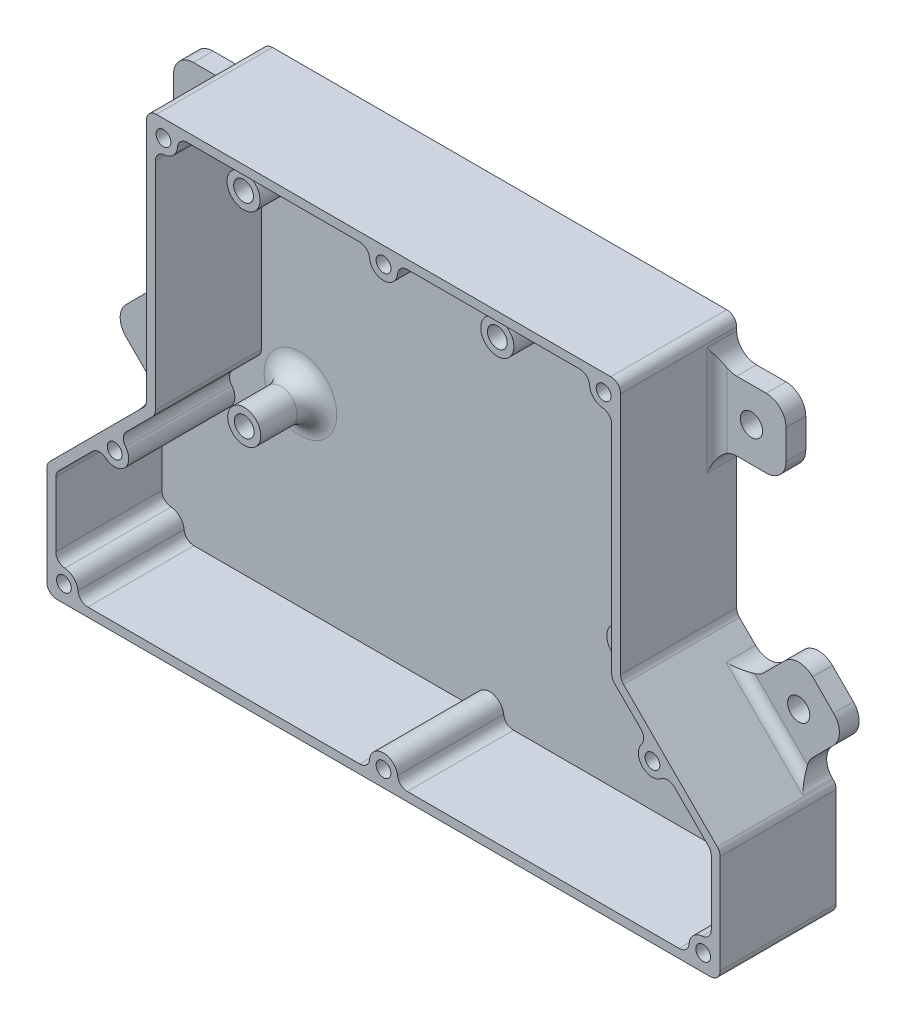
from build123d import *

# Parameters (mm, degrees)
BOSS_EXTRUDE1_DEPTH       = 2
BOSS_EXTRUDE2_DEPTH       = 21.5
FILLET1_R                 = 2
FILLET2_R                 = 2
BOSS_EXTRUDE3_START       = -22
BOSS_EXTRUDE3_OUTLINE_R   = 1.498302823
BOSS_EXTRUDE3_OUTLINE_R_2 = 1.5
BOSS_EXTRUDE3_DEPTH       = 22
FILLET3_R                 = 2
SKETCH5_R                 = 3.35
SKETCH5_R_2               = 2
BOSS_EXTRUDE4_DEPTH       = 11.389696517
FILLET4_R                 = 4
SKETCH6_W                 = 14
SKETCH6_H                 = 14
SKETCH6_R                 = 2.25
BOSS_EXTRUDE5_DEPTH       = 4
FILLET5_R                 = 4
FILLET6_R                 = 2


with BuildPart() as part:
    # Sketch3 → Boss-Extrude1 (new body)
    with BuildSketch(Plane.XY):
        Polygon((-15.640963985, -84.058941087), (4.526340861, -63.891636241), (4.526340861, -11.788708514), (100.581340861, -11.788708514), (100.581340861, -63.896636241), (120.743645706, -84.058941087), (120.743645706, -106.958318205), (104.551340861, -106.958318205), (-15.640963985, -106.958318205), (-15.640963985, -90.76601336), align=None)
    extrude(amount=-BOSS_EXTRUDE1_DEPTH)

    # Sketch3<3> → Boss-Extrude2 (add)
    with BuildSketch(Plane.XY):
        Polygon((-15.640963985, -90.76601336), (-15.640963985, -84.058941087), (4.526340861, -63.891636241), (4.526340861, -11.788708514), (100.581340861, -11.788708514), (100.581340861, -63.896636241), (120.743645706, -84.058941087), (120.743645706, -106.958318205), (104.551340861, -106.958318205), (-15.640963985, -106.958318205), align=None)
        Polygon((-13.840963985, -90.76601336), (-13.840963985, -105.158318205), (104.551340861, -105.158318205), (118.943645706, -105.158318205), (118.943645706, -84.804525499), (98.781340861, -64.642220653), (98.781340861, -13.588708514), (6.326340861, -13.588708514), (6.326340861, -64.637220653), (-13.840963985, -84.804525499), align=None, mode=Mode.SUBTRACT)
    extrude(amount=BOSS_EXTRUDE2_DEPTH)

    # Fillet1
    fillet1_edges = [part.edges().sort_by_distance(p)[0] for p in [
        (-15.640963985, -84.058941087, 9.75),
        (4.526340861, -63.891636241, 9.75),
        (4.526340861, -11.788708514, 9.75),
        (100.581340861, -11.788708514, 9.75),
        (100.581340861, -63.896636241, 9.75),
        (120.743645706, -84.058941087, 9.75),
        (120.743645706, -106.958318205, 9.75),
        (-15.640963985, -106.958318205, 9.75),
        (-13.840963985, -105.158318205, 10.75),
        (-13.840963985, -84.804525499, 10.75),
        (6.326340861, -64.637220653, 10.75),
        (6.326340861, -13.588708514, 10.75),
        (98.781340861, -13.588708514, 10.75),
        (98.781340861, -64.642220653, 10.75),
        (118.943645706, -105.158318205, 10.75),
    ]]
    fillet(fillet1_edges, radius=FILLET1_R)

    # Fillet2
    fillet2_edges = [part.edges().sort_by_distance(p)[0] for p in [
        (118.943645706, -84.804525499, 10.75),
    ]]
    fillet(fillet2_edges, radius=FILLET2_R)

    # Boss-Extrude3: read off the stored shape, not the designer's step
    # Boss-Extrude3 outline → Boss-Extrude3 (add)
    with BuildSketch(Plane.XY.offset(21.5).offset(BOSS_EXTRUDE3_START)):
        with BuildLine():
            ThreePointArc((101.167127298, -64.482422679), (100.733581796, -63.833575981), (100.581340861, -63.068209116))
            Line((100.581340861, -63.068209116), (100.581340861, -13.788708514))
            ThreePointArc((100.581340861, -13.788708514), (99.995554423, -12.374494952), (98.581340861, -11.788708514))
            Line((98.581340861, -11.788708514), (6.526340861, -11.788708514))
            ThreePointArc((6.526340861, -11.788708514), (5.112127298, -12.374494952), (4.526340861, -13.788708514))
            Line((4.526340861, -13.788708514), (4.526340861, -63.063209116))
            ThreePointArc((4.526340861, -63.063209116), (4.374099926, -63.828575981), (3.940554423, -64.477422679))
            Line((3.940554423, -64.477422679), (-15.055177547, -83.473154649))
            ThreePointArc((-15.055177547, -83.473154649), (-15.48872305, -84.122001347), (-15.640963985, -84.887368211))
            Line((-15.640963985, -84.887368211), (-15.640963985, -104.958318205))
            ThreePointArc((-15.640963985, -104.958318205), (-15.055177547, -106.372531767), (-13.640963985, -106.958318205))
            Line((-13.640963985, -106.958318205), (118.743645706, -106.958318205))
            ThreePointArc((118.743645706, -106.958318205), (120.157859269, -106.372531767), (120.743645706, -104.958318205))
            Line((120.743645706, -104.958318205), (120.743645706, -84.887368211))
            ThreePointArc((120.743645706, -84.887368211), (120.591404771, -84.122001347), (120.157859269, -83.473154649))
            Line((120.157859269, -83.473154649), (101.167127298, -64.482422679))
        make_face()
        with Locations((-12.195717461, -103.513071681)):
            Circle(BOSS_EXTRUDE3_OUTLINE_R, mode=Mode.SUBTRACT)
        with Locations((-1.913886606, -74.998768464)):
            Circle(BOSS_EXTRUDE3_OUTLINE_R_2, mode=Mode.SUBTRACT)
        with Locations((52.551340861, -103.658318205)):
            Circle(BOSS_EXTRUDE3_OUTLINE_R_2, mode=Mode.SUBTRACT)
        with Locations((117.297199097, -103.511871596)):
            Circle(BOSS_EXTRUDE3_OUTLINE_R_2, mode=Mode.SUBTRACT)
        with Locations((107.016568327, -74.998768464)):
            Circle(BOSS_EXTRUDE3_OUTLINE_R_2, mode=Mode.SUBTRACT)
        with BuildLine():
            ThreePointArc((-13.840963985, -85.632952624), (-13.68872305, -84.867585759), (-13.255177547, -84.218739061))
            Line((-13.255177547, -84.218739061), (-4.688095726, -75.651657241))
            ThreePointArc((-4.688095726, -75.651657241), (0.101367721, -77.01402279), (-1.260997829, -72.224559343))
            Line((-1.260997829, -72.224559343), (5.740554423, -65.223007091))
            ThreePointArc((5.740554423, -65.223007091), (6.174099926, -64.574160393), (6.326340861, -63.808793529))
            Line((6.326340861, -63.808793529), (6.326340861, -17.561464123))
            ThreePointArc((6.326340861, -17.561464123), (9.988041797, -17.25040945), (10.29909647, -13.588708514))
            Line((10.29909647, -13.588708514), (50.130516698, -13.588708514))
            ThreePointArc((50.130516698, -13.588708514), (52.553840861, -17.938708514), (54.977165024, -13.588708514))
            Line((54.977165024, -13.588708514), (94.808585252, -13.588708514))
            ThreePointArc((94.808585252, -13.588708514), (95.119639925, -17.25040945), (98.781340861, -17.561464123))
            Line((98.781340861, -17.561464123), (98.781340861, -63.813793529))
            ThreePointArc((98.781340861, -63.813793529), (98.933581796, -64.579160393), (99.367127298, -65.228007091))
            Line((99.367127298, -65.228007091), (106.36367955, -72.224559343))
            ThreePointArc((106.36367955, -72.224559343), (105.001314001, -77.01402279), (109.790777448, -75.651657241))
            Line((109.790777448, -75.651657241), (118.357859269, -84.218739061))
            ThreePointArc((118.357859269, -84.218739061), (118.791404771, -84.867585759), (118.943645706, -85.632952624))
            Line((118.943645706, -85.632952624), (118.943645706, -101.185562596))
            ThreePointArc((118.943645706, -101.185562596), (115.28194477, -101.496617269), (114.970890097, -105.158318205))
            Line((114.970890097, -105.158318205), (54.974665024, -105.158318205))
            ThreePointArc((54.974665024, -105.158318205), (52.551340861, -100.808318205), (50.128016698, -105.158318205))
            Line((50.128016698, -105.158318205), (-9.870638356, -105.158318205))
            ThreePointArc((-9.870638356, -105.158318205), (-10.18166322, -101.49901744), (-13.840963985, -101.187992576))
            Line((-13.840963985, -101.187992576), (-13.840963985, -85.632952624))
        make_face(mode=Mode.SUBTRACT)
        with Locations((7.97278747, -15.235155124)):
            Circle(BOSS_EXTRUDE3_OUTLINE_R_2, mode=Mode.SUBTRACT)
        with Locations((52.553840861, -15.088708514)):
            Circle(BOSS_EXTRUDE3_OUTLINE_R_2, mode=Mode.SUBTRACT)
        with Locations((97.134894251, -15.235155124)):
            Circle(BOSS_EXTRUDE3_OUTLINE_R_2, mode=Mode.SUBTRACT)
    extrude(amount=BOSS_EXTRUDE3_DEPTH)

    # Fillet3
    fillet3_edges = [part.edges().sort_by_distance(p)[0] for p in [
        (10.29909647, -13.588708514, 10.75),
        (6.326340861, -17.561464123, 10.75),
        (54.977165024, -13.588708514, 10.75),
        (50.130516698, -13.588708514, 10.75),
        (94.808585252, -13.588708514, 10.75),
        (98.781340861, -17.561464123, 10.75),
        (109.790777448, -75.651657241, 10.75),
        (106.36367955, -72.224559343, 10.75),
        (118.943645706, -101.185562596, 10.75),
        (114.970890097, -105.158318205, 10.75),
        (50.128016698, -105.158318205, 10.75),
        (54.974665024, -105.158318205, 10.75),
        (-9.870638356, -105.158318205, 10.75),
        (-13.840963985, -101.187992576, 10.75),
        (-4.688095726, -75.651657241, 10.75),
        (-1.260997829, -72.224559343, 10.75),
    ]]
    fillet(fillet3_edges, radius=FILLET3_R)

    # Sketch5 → Boss-Extrude4 (add)
    # profile 1 of 4: a face of its own
    with BuildSketch(Plane.XY):
        with Locations(Location((14.085540861, -26.462708514, 0), (0, 0, 270))):
            Circle(SKETCH5_R)
        with Locations(Location((14.085540861, -26.462708514, 0), (0, 0, 270))):
            Circle(SKETCH5_R_2, mode=Mode.SUBTRACT)
    # profile 2 of 4: a face of its own
    with BuildSketch(Plane.XY):
        with Locations(Location((14.225240861, -67.737708514, 0), (0, 0, 270))):
            Circle(SKETCH5_R)
        with Locations(Location((14.225240861, -67.737708514, 0), (0, 0, 270))):
            Circle(SKETCH5_R_2, mode=Mode.SUBTRACT)
    # profile 3 of 4: a face of its own
    with BuildSketch(Plane.XY):
        with Locations(Location((65.495140861, -26.462708514, 0), (0, 0, 270))):
            Circle(SKETCH5_R)
        with Locations(Location((65.495140861, -26.462708514, 0), (0, 0, 270))):
            Circle(SKETCH5_R_2, mode=Mode.SUBTRACT)
    # profile 4 of 4: a face of its own
    with BuildSketch(Plane.XY):
        with Locations(Location((91.034840861, -67.737708514, 0), (0, 0, 270))):
            Circle(SKETCH5_R)
        with Locations(Location((91.034840861, -67.737708514, 0), (0, 0, 270))):
            Circle(SKETCH5_R_2, mode=Mode.SUBTRACT)
    extrude(amount=BOSS_EXTRUDE4_DEPTH)

    # Fillet4
    fillet4_edges = [part.edges().sort_by_distance(p)[0] for p in [
        (14.085540861, -23.112708514, 0),
        (14.225240861, -64.387708514, 0),
        (65.495140861, -23.112708514, 0),
        (91.034840861, -64.387708514, 0),
    ]]
    fillet(fillet4_edges, radius=FILLET4_R)

    # Sketch6 → Boss-Extrude5 (add)
    # profile 1 of 4: a face of its own
    with BuildSketch(Plane(origin=(0, 0, -2), x_dir=(-1, 0, 0), z_dir=(0, 0, -1))):
        with Locations((2.473659139, -25.447541822)):
            Rectangle(SKETCH6_W, SKETCH6_H)
        with Locations((2.473659139, -25.447541822)):
            Circle(SKETCH6_R, mode=Mode.SUBTRACT)
    # profile 2 of 4: a face of its own
    with BuildSketch(Plane(origin=(0, 0, -2), x_dir=(-1, 0, 0), z_dir=(0, 0, -1))):
        with Locations((-107.581340861, -25.447541822)):
            Rectangle(SKETCH6_W, SKETCH6_H)
        with Locations((-107.581340861, -25.447541822)):
            Circle(SKETCH6_R, mode=Mode.SUBTRACT)
    # profile 3 of 4: a face of its own
    with BuildSketch(Plane(origin=(0, 0, -2), x_dir=(-1, 0, 0), z_dir=(0, 0, -1))):
        Polygon((12.051404357, -80.469381459), (21.950899294, -70.569886522), (12.051404357, -60.670391586), (2.15190942, -70.569886522), align=None)
        with Locations((12.051404357, -70.569886522)):
            Circle(SKETCH6_R, mode=Mode.SUBTRACT)
    # profile 4 of 4: a face of its own
    with BuildSketch(Plane(origin=(0, 0, -2), x_dir=(-1, 0, 0), z_dir=(0, 0, -1))):
        Polygon((-107.254591142, -70.569886522), (-117.154086078, -60.670391586), (-127.053581015, -70.569886522), (-117.154086078, -80.469381459), align=None)
        with Locations((-117.154086078, -70.569886522)):
            Circle(SKETCH6_R, mode=Mode.SUBTRACT)
    extrude(amount=-BOSS_EXTRUDE5_DEPTH)

    # Fillet5
    fillet5_edges = [part.edges().sort_by_distance(p)[0] for p in [
        (4.526340861, -32.447541822, 0),
        (4.526340861, -18.447541822, 0),
        (-9.473659139, -18.447541822, 0),
        (-9.473659139, -32.447541822, 0),
        (100.581340861, -18.447541822, 0),
        (100.581340861, -32.447541822, 0),
        (114.581340861, -32.447541822, 0),
        (114.581340861, -18.447541822, 0),
        (-12.051404357, -80.469381459, 0),
        (-2.15190942, -70.569886522, 0),
        (-12.051404357, -60.670391586, 0),
        (-21.950899294, -70.569886522, 0),
        (107.254591142, -70.569886522, 0),
        (117.154086078, -80.469381459, 0),
        (127.053581015, -70.569886522, 0),
        (117.154086078, -60.670391586, 0),
    ]]
    fillet(fillet5_edges, radius=FILLET5_R)

    # Fillet6
    fillet6_edges = [part.edges().sort_by_distance(p)[0] for p in [
        (4.526340861, -25.447541822, 2),
        (100.581340861, -25.447541822, 2),
        (-7.101656889, -75.519633991, 2),
        (112.20433861, -75.519633991, 2),
    ]]
    fillet(fillet6_edges, radius=FILLET6_R)


solid = part.part
